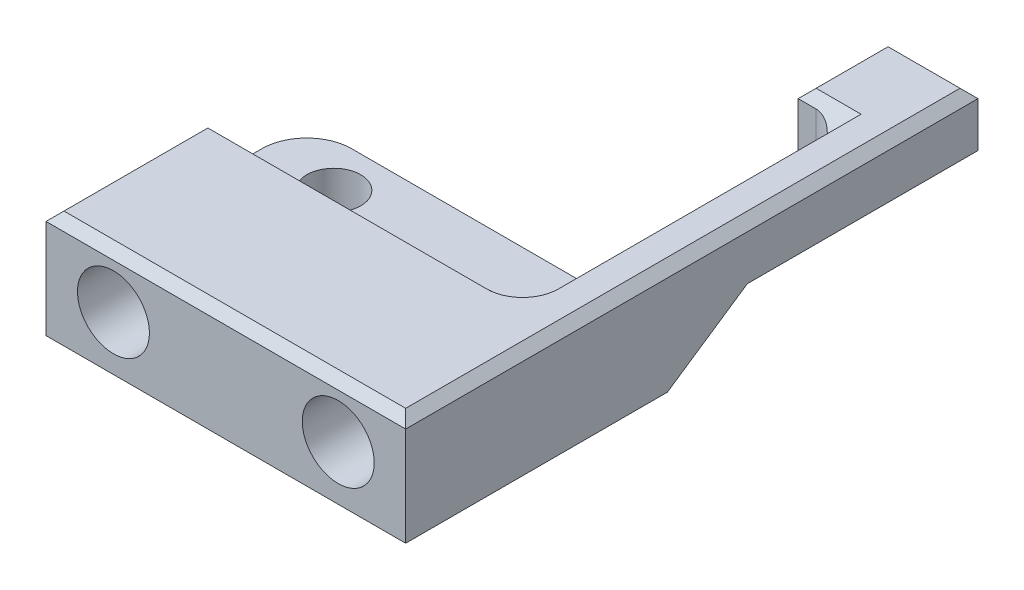
from build123d import *

# Parameters (mm, degrees)
SKETCH1_W           = 40
SKETCH1_H           = 30
BOSS_EXTRUDE1_DEPTH = 12
SKETCH2_W           = 25
SKETCH2_H           = 12
CUT_EXTRUDE1_DEPTH  = 12
SKETCH3_R           = 4
CUT_EXTRUDE2_DEPTH  = 100
FILLET1_R           = 5
SKETCH4_R           = 4
CUT_EXTRUDE3_DEPTH  = 12.5
SKETCH6_W           = 44.346855167
SKETCH6_H           = 29.153227126
CUT_EXTRUDE4_DEPTH  = 100
SKETCH7_W           = 40
SKETCH7_H           = 6
BOSS_EXTRUDE2_DEPTH = 20
SKETCH8_W           = 5
SKETCH8_H           = 20
SKETCH8_H_2         = 10
BOSS_EXTRUDE3_DEPTH = 6
SKETCH9_R           = 3
SKETCH9_W           = 35
SKETCH9_H           = 9
CUT_EXTRUDE5_DEPTH  = 20
CHAMFER2_SIZE2      = 6
CHAMFER2_SIZE       = 8.895365811
FILLET2_R           = 5
FILLET3_R           = 3
CHAMFER3_SIZE       = 1
FILLET4_R           = 3


with BuildPart() as part:
    # Sketch1 → Boss-Extrude1 (new body)
    with BuildSketch(Plane(origin=(0, 0, 0), x_dir=(1, 0, 0), z_dir=(0, 1, 0))):
        Rectangle(SKETCH1_W, SKETCH1_H)
    extrude(amount=BOSS_EXTRUDE1_DEPTH)

    # Sketch2 → Cut-Extrude1 (cut)
    with BuildSketch(Plane(origin=(0, 12, 0), x_dir=(1, 0, 0), z_dir=(0, 1, 0))):
        with Locations((0, 9)):
            Rectangle(SKETCH2_W, SKETCH2_H)
    extrude(amount=-CUT_EXTRUDE1_DEPTH, mode=Mode.SUBTRACT)

    # Sketch3 → Cut-Extrude2 (cut)
    with BuildSketch(Plane(origin=(20, 0, 0), x_dir=(0, 0, -1), z_dir=(1, 0, 0))):
        with Locations((9, 6)):
            Circle(SKETCH3_R)
    extrude(amount=-CUT_EXTRUDE2_DEPTH, mode=Mode.SUBTRACT)

    # Fillet1
    fillet1_edges = [part.edges().sort_by_distance(p)[0] for p in [
        (-16.25, 0, -15),
        (-16.25, 12, -15),
        (16.25, 0, -15),
        (16.25, 12, -15),
    ]]
    fillet(fillet1_edges, radius=FILLET1_R)

    # Sketch4 → Cut-Extrude3 (cut)
    with BuildSketch(Plane.XY.offset(15)):
        with Locations((-12.5, 6)):
            Circle(SKETCH4_R)
        with Locations((12.5, 6)):
            Circle(SKETCH4_R)
    extrude(amount=-CUT_EXTRUDE3_DEPTH, mode=Mode.SUBTRACT)

    # Sketch6 → Cut-Extrude4 (cut)
    with BuildSketch(Plane(origin=(0, 12, 0), x_dir=(1, 0, 0), z_dir=(0, 1, 0))):
        with Locations((2.173427584, 17.576613563)):
            Rectangle(SKETCH6_W, SKETCH6_H)
    extrude(amount=-CUT_EXTRUDE4_DEPTH, mode=Mode.SUBTRACT)

    # Sketch7 → Boss-Extrude2 (add)
    with BuildSketch(Plane(origin=(0, 0, -3), x_dir=(-1, 0, 0), z_dir=(0, 0, -1))):
        with Locations((0, 3)):
            Rectangle(SKETCH7_W, SKETCH7_H)
    extrude(amount=BOSS_EXTRUDE2_DEPTH)

    # Sketch8 → Boss-Extrude3 (add)
    with BuildSketch(Plane(origin=(0, 6, 0), x_dir=(1, 0, 0), z_dir=(0, 1, 0))):
        Polygon((15, 23), (20, 23), (20, 48.649342911), (15, 48.649342911), (15, 38.649342911), align=None)
        with Locations((17.5, 13)):
            Rectangle(SKETCH8_W, SKETCH8_H)
        with Locations((12.5, 43.649342911)):
            Rectangle(SKETCH8_W, SKETCH8_H_2)
    extrude(amount=BOSS_EXTRUDE3_DEPTH)

    # Sketch9 → Cut-Extrude5 (cut)
    with BuildSketch(Plane(origin=(0, 6, 0), x_dir=(1, 0, 0), z_dir=(0, 1, 0))):
        with Locations(Location((-12, 9, 0), (0, 0, 270))):
            Circle(SKETCH9_R)
        with Locations((-2.5, 18.5)):
            Rectangle(SKETCH9_W, SKETCH9_H)
    extrude(amount=-CUT_EXTRUDE5_DEPTH, mode=Mode.SUBTRACT)

    # Chamfer2
    chamfer2_edges = [part.edges().sort_by_distance(p)[0] for p in [
        (17.5, 0, -23),
    ]]
    chamfer2_side = [part.faces().sort_by_distance(p)[0] for p in [
        (17.5, 0, -22.88),
    ]]
    chamfer(chamfer2_edges, length=CHAMFER2_SIZE - 0.0001, length2=CHAMFER2_SIZE2 - 0.0001, reference=chamfer2_side[0])  # a hair under: the kernel refuses the full size

    # Fillet2
    fillet2_edges = [part.edges().sort_by_distance(p)[0] for p in [
        (-20, 3, -14),
        (15, 3, -14),
    ]]
    fillet(fillet2_edges, radius=FILLET2_R)

    # Fillet3
    fillet3_edges = [part.edges().sort_by_distance(p)[0] for p in [
        (-2.5, 6, -3),
        (15, 6, -11),
        (15, 9, -3),
    ]]
    fillet(fillet3_edges, radius=FILLET3_R - 0.0001)  # a hair under: the kernel refuses the full size

    # Chamfer3
    chamfer3_edges = [part.edges().sort_by_distance(p)[0] for p in [
        (15, 12, -48.649342911),
        (10, 12, -43.649342911),
        (15, 12, -22.324621456),
        (12.5, 12, -38.649342911),
        (0, 12, 15),
        (14.121349633, 12, -3.878650367),
        (-3.99995, 12, -3),
        (20, 12, -16.824671456),
        (-20, 12, 6),
    ]]
    chamfer(chamfer3_edges, length=CHAMFER3_SIZE)

    # Fillet4
    fillet4_edges = [part.edges().sort_by_distance(p)[0] for p in [
        (15, 8.5, -38.649342911),
    ]]
    fillet(fillet4_edges, radius=FILLET4_R)


solid = part.part
